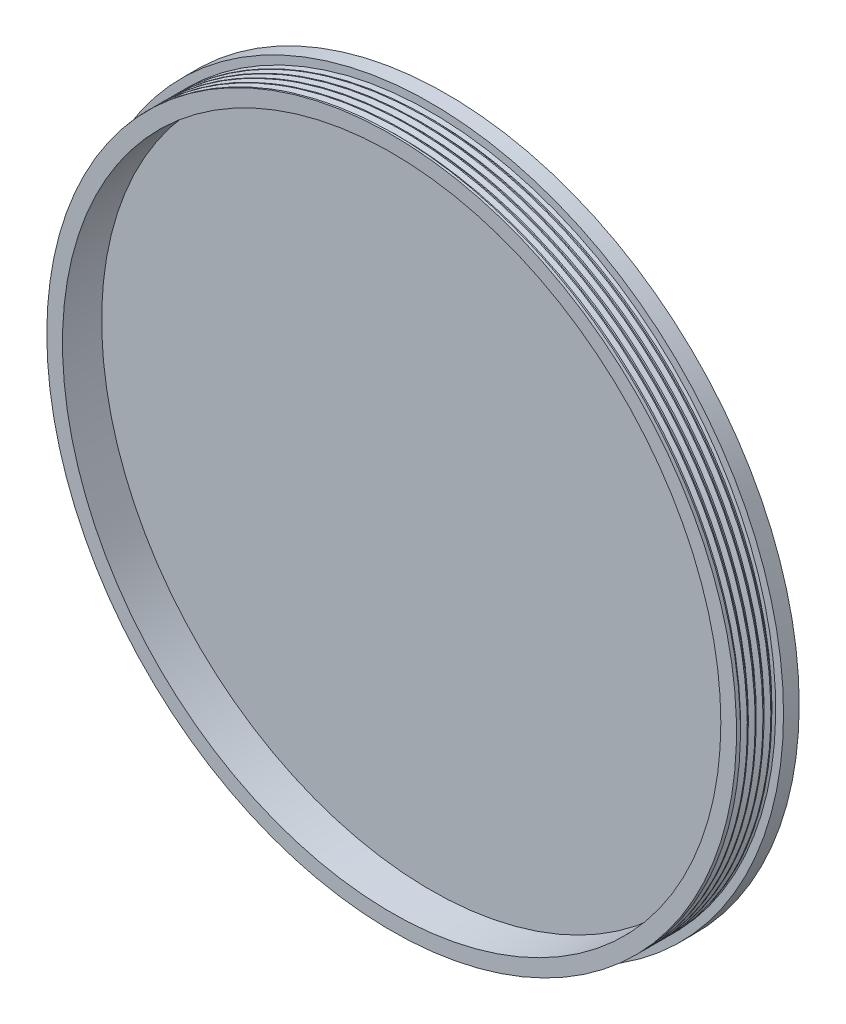
from build123d import *

# Parameters (mm, degrees)
SKETCH_1_R          = 45
EXTRUDE_1_DEPTH     = 2
SKETCH_2_R          = 44
EXTRUDE_2_DEPTH     = 5
THREAD_1_PITCH      = 1
SKETCH_5_R          = 42
CUT_EXTRUDE_1_DEPTH = 5


with BuildPart() as part:
    # Sketch 1 → Бобышка-Вытянуть1 (new body)
    with BuildSketch(Plane.XY):
        Circle(SKETCH_1_R)
    extrude(amount=EXTRUDE_1_DEPTH)

    # Эскиз2 → Бобышка-Вытянуть2 (add)
    with BuildSketch(Plane.XY.offset(2)):
        Circle(SKETCH_2_R)
    extrude(amount=EXTRUDE_2_DEPTH)

    # Резьба1: the profile of Sketch 1 2 profile screwed along a right-hand helix of 5 turns, 8 arcs to a turn; built about Z, then put on its axis
    thread_1_z = Axis((0, 0, 0), (0, 0, 1))
    thread_1_corners = [(44.0003, 0, -0.000173205), (44.0003, 0, 0.875173202), (43.458734125, 0, 0.562499999), (43.458734125, 0, 0.312499999)]
    with BuildLine(mode=Mode.PRIVATE) as thread_1_profile:
        Line(thread_1_corners[0], thread_1_corners[1])
        Line(thread_1_corners[1], thread_1_corners[2])
        Line(thread_1_corners[2], thread_1_corners[3])
        Line(thread_1_corners[3], thread_1_corners[0])
    thread_1_cap = Face(thread_1_profile.wire())
    thread_1_turn_angles = [0, 22.5, 45, 67.5, 90, 112.5, 135, 157.5, 180, 202.5, 225, 247.5, 270, 292.5, 315, 337.5, 360]
    thread_1_turn_weights = [1, 0.9238795325112867, 1, 0.9238795325112867, 1, 0.9238795325112867, 1, 0.9238795325112867, 1, 0.9238795325112867, 1, 0.9238795325112867, 1, 0.9238795325112867, 1, 0.9238795325112867, 1]
    thread_1_turn_rails = [Edge.make_bspline([Vector(p[0], p[1], 0).rotate(thread_1_z, thread_1_turn_angles[k]) / thread_1_turn_weights[k] + Vector(0, 0, p[2] + THREAD_1_PITCH * thread_1_turn_angles[k] / 360) for k in range(17)], [0, 0, 0, 1, 1, 2, 2, 3, 3, 4, 4, 5, 5, 6, 6, 7, 7, 8, 8, 8], 2, thread_1_turn_weights) for p in thread_1_corners]
    thread_1_turn_sides = [Face.make_surface_from_curves(thread_1_turn_rails[p[0]], thread_1_turn_rails[p[1]]) for p in [(0, 1), (1, 2), (2, 3), (3, 0)]]
    thread_1 = Plane(origin=(0, 0, 7), x_dir=(-1, 0, 0), z_dir=(0, 0, -1)) * Solid(Shell([*[p.moved(Location((0, 0, THREAD_1_PITCH * i))) for i in range(5) for p in thread_1_turn_sides], thread_1_cap, thread_1_cap.rotate(thread_1_z, 1800).moved(Location((0, 0, THREAD_1_PITCH * 1800 / 360)))]))
    add(thread_1, mode=Mode.SUBTRACT)

    # Эскиз5 → Вырез-Вытянуть1 (cut)
    with BuildSketch(Plane.XY.offset(7)):
        Circle(SKETCH_5_R)
    extrude(amount=-CUT_EXTRUDE_1_DEPTH, mode=Mode.SUBTRACT)


solid = part.part
